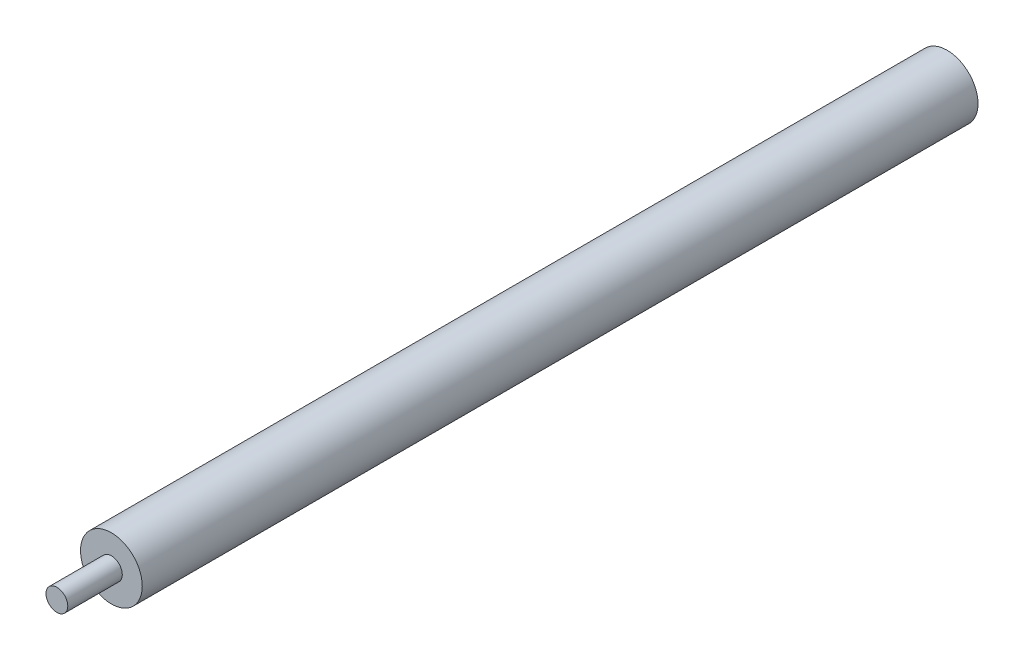
from build123d import *

# Parameters (mm, degrees)
SKETCH1_R           = 8.5
BOSS_EXTRUDE1_DEPTH = 230
SKETCH2_R           = 3
BOSS_EXTRUDE2_DEPTH = 15


with BuildPart() as part:
    # Sketch1 → Boss-Extrude1 (new body)
    with BuildSketch(Plane.XY):
        Circle(SKETCH1_R)
    extrude(amount=BOSS_EXTRUDE1_DEPTH)

    # Sketch2 → Boss-Extrude2 (add)
    with BuildSketch(Plane.XY.offset(230)):
        Circle(SKETCH2_R)
    extrude(amount=BOSS_EXTRUDE2_DEPTH)


solid = part.part
